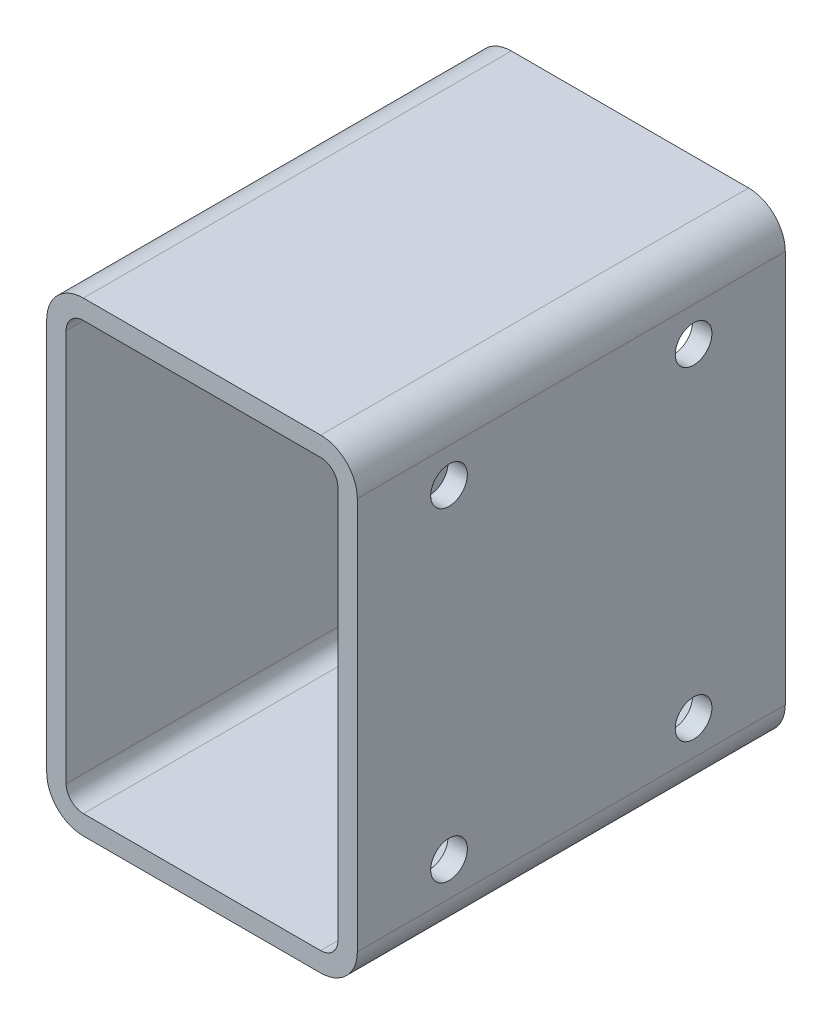
from build123d import *

# Parameters (mm, degrees)
BOSS_EXTRUDE1_DEPTH = 35
SKETCH2_R           = 3
CUT_EXTRUDE1_DEPTH  = 10


with BuildPart() as part:
    # Sketch1 → Boss-Extrude1 (new, symmetric)
    with BuildSketch(Plane.XY):
        with BuildLine():
            Line((19.4, -38.1), (-19.4, -38.1))
            ThreePointArc((-19.4, -38.1), (-23.642640687, -36.342640687), (-25.4, -32.1))
            Line((-25.4, -32.1), (-25.4, 32.1))
            ThreePointArc((-25.4, 32.1), (-23.642640687, 36.342640687), (-19.4, 38.1))
            Line((-19.4, 38.1), (19.4, 38.1))
            ThreePointArc((19.4, 38.1), (23.642640687, 36.342640687), (25.4, 32.1))
            Line((25.4, 32.1), (25.4, -32.1))
            ThreePointArc((25.4, -32.1), (23.642640687, -36.342640687), (19.4, -38.1))
        make_face()
        with BuildLine():
            Line((19.4, 34.925), (-19.4, 34.925))
            ThreePointArc((-19.4, 34.925), (-21.397576657, 34.097576657), (-22.225, 32.1))
            Line((-22.225, 32.1), (-22.225, -32.1))
            ThreePointArc((-22.225, -32.1), (-21.397576657, -34.097576657), (-19.4, -34.925))
            Line((-19.4, -34.925), (19.4, -34.925))
            ThreePointArc((19.4, -34.925), (21.397576657, -34.097576657), (22.225, -32.1))
            Line((22.225, -32.1), (22.225, 32.1))
            ThreePointArc((22.225, 32.1), (21.397576657, 34.097576657), (19.4, 34.925))
        make_face(mode=Mode.SUBTRACT)
    extrude(amount=BOSS_EXTRUDE1_DEPTH, both=True)

    # Sketch2 → Cut-Extrude1 (cut)
    with BuildSketch(Plane(origin=(25.4, 0, 0), x_dir=(0, 0, -1), z_dir=(1, 0, 0))):
        with Locations((-20, 26.5)):
            Circle(SKETCH2_R)
        with Locations((20, 26.5)):
            Circle(SKETCH2_R)
        with Locations((20, -26.5)):
            Circle(SKETCH2_R)
        with Locations((-20, -26.5)):
            Circle(SKETCH2_R)
    extrude(amount=-CUT_EXTRUDE1_DEPTH, mode=Mode.SUBTRACT)


solid = part.part
